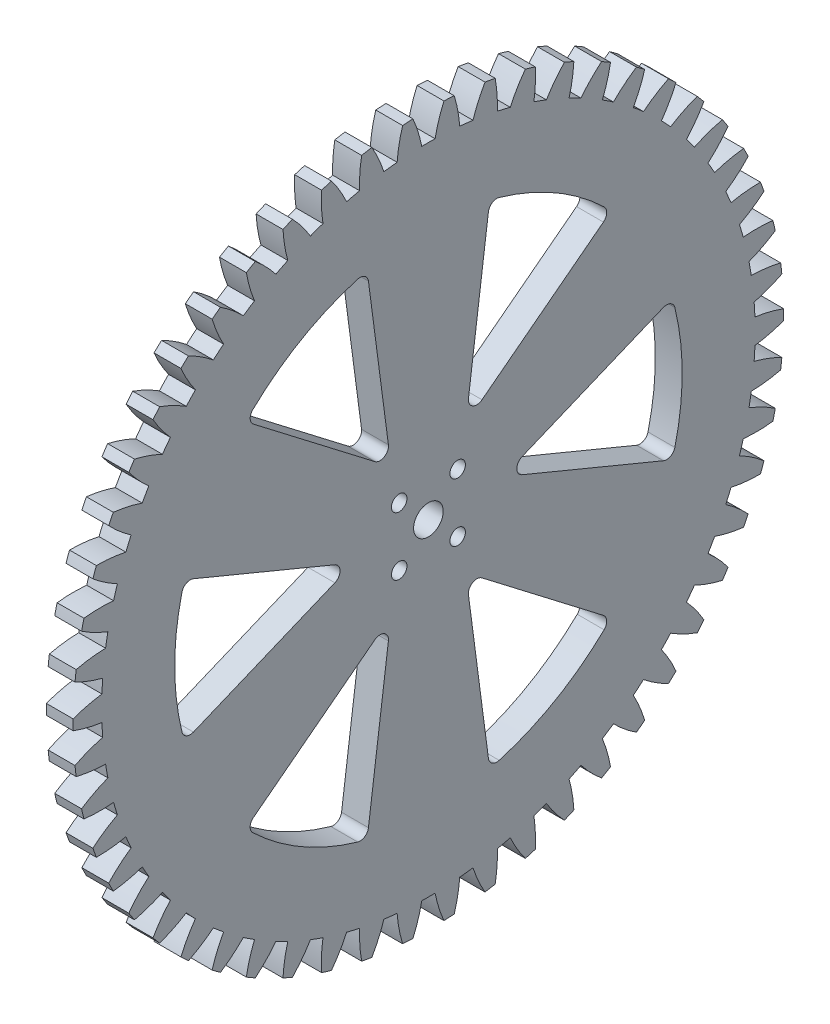
from build123d import *

# Parameters (mm, degrees)
BASPROSKE_W                        = 6.35
BASPROSKE_H                        = 84
TOOTHCUT_DEPTH                     = 119.963534329
TEETHCUTS_COUNT                    = 54
TEETHCUTS_ANGLE                    = 353.333333333
BORSKE_R                           = 3.5
BORE_DEPTH                         = 50.0000508
ENL_V_MAT_EXTRU_1_REACH            = 120.907
ESQUISSE1_R                        = 1.83
R_P_TITION_CIRCULAIRE1_COUNT       = 4
ENL_V_MAT_EXTRU_2_REACH            = 120.907
CONG_1_R                           = 2
R_P_TITION_CIRCULAIRE2_COUNT       = 6
CONG_1_OF_R_P_TITION_CIRCULAIRE2_R = 2


with BuildPart() as part:
    # BasProSke → Base-Revolve (revolve)
    with BuildSketch(Plane(origin=(0, 0, 0), x_dir=(1, 0, 0), z_dir=(0, 1, 0))):
        with Locations((3.175, 42)):
            Rectangle(BASPROSKE_W, BASPROSKE_H)
    revolve(axis=Axis((-10, 0, 0), (1, 0, 0)))

    # TooCutSke → ToothCut (cut, through all)
    with BuildSketch(Plane(origin=(0, 0, 0), x_dir=(0, 0, -1), z_dir=(1, 0, 0))):
        with BuildLine():
            ThreePointArc((1.575386603, 77.232934413), (0, 77.249), (-1.575386603, 77.232934413))
            ThreePointArc((-1.575386603, 77.232934413), (-2.443081828, 80.646109861), (-3.676100496, 83.944947021))
            ThreePointArc((-3.676100496, 83.944947021), (0, 84.0254), (3.676100496, 83.944947021))
            ThreePointArc((3.676100496, 83.944947021), (2.443081828, 80.646109861), (1.575386603, 77.232934413))
        make_face()
    toothcut = extrude(amount=TOOTHCUT_DEPTH, mode=Mode.SUBTRACT)

    # TeethCuts: ToothCut ×54 about axis
    teethcuts_axis = Axis((-10, 0, 0), (1, 0, 0))
    for i in range(1, TEETHCUTS_COUNT):
        add(toothcut.rotate(teethcuts_axis, i * TEETHCUTS_ANGLE / (TEETHCUTS_COUNT - 1)), mode=Mode.SUBTRACT)

    # BorSke → Bore (cut, symmetric)
    with BuildSketch(Plane(origin=(0, 0, 0), x_dir=(0, 0, -1), z_dir=(1, 0, 0))):
        Circle(BORSKE_R)
    extrude(amount=BORE_DEPTH, both=True, mode=Mode.SUBTRACT)

    # Esquisse1 → Enlèv. mat.-Extru.1 (cut, up to next)
    with BuildSketch(Plane.ZY, mode=Mode.PRIVATE) as enl_v_mat_extru_1_sk1:
        with Locations((6.914797213, 6.914797213)):
            Circle(ESQUISSE1_R)
    enl_v_mat_extru_1_tool1 = extrude(enl_v_mat_extru_1_sk1.sketch, amount=-ENL_V_MAT_EXTRU_1_REACH, mode=Mode.PRIVATE) & part.part
    enl_v_mat_extru_1 = enl_v_mat_extru_1_tool1.solids().sort_by_distance((0, 6.914797, 6.914797))[0]
    add(enl_v_mat_extru_1, mode=Mode.SUBTRACT)

    # Répétition circulaire1: Enlèv. mat.-Extru.1 ×4 about axis
    r_p_tition_circulaire1_axis = Axis((0, 0, 0), (-1, 0, 0))
    for i in range(1, R_P_TITION_CIRCULAIRE1_COUNT):
        add(enl_v_mat_extru_1.rotate(r_p_tition_circulaire1_axis, i * 360 / R_P_TITION_CIRCULAIRE1_COUNT), mode=Mode.SUBTRACT)

    # Esquisse2 → Enlèv. mat.-Extru.2 (cut, up to next)
    with BuildSketch(Plane.ZY, mode=Mode.PRIVATE) as enl_v_mat_extru_2_sk1:
        with BuildLine():
            Line((17.667004427, 0), (57.667004427, 16.568542495))
            ThreePointArc((57.667004427, 16.568542495), (60, 0), (57.667004427, -16.568542495))
            Line((57.667004427, -16.568542495), (17.667004427, 0))
        make_face()
    enl_v_mat_extru_2_tool1 = extrude(enl_v_mat_extru_2_sk1.sketch, amount=-ENL_V_MAT_EXTRU_2_REACH, mode=Mode.PRIVATE) & part.part
    enl_v_mat_extru_2 = enl_v_mat_extru_2_tool1.solids().sort_by_distance((0, 0, 45.366966))[0]
    add(enl_v_mat_extru_2, mode=Mode.SUBTRACT)

    # Congé1
    cong_1_edges = [part.edges().sort_by_distance(p)[0] for p in [
        (3.175, 0, 17.667004427),
        (3.175, -16.568542495, 57.667004427),
        (3.175, 16.568542495, 57.667004427),
    ]]
    fillet(cong_1_edges, radius=CONG_1_R)

    # Répétition circulaire2: Enlèv. mat.-Extru.2 ×6 about axis
    r_p_tition_circulaire2_axis = Axis((0, 0, 0), (-1, 0, 0))
    for i in range(1, R_P_TITION_CIRCULAIRE2_COUNT):
        add(enl_v_mat_extru_2.rotate(r_p_tition_circulaire2_axis, i * 360 / R_P_TITION_CIRCULAIRE2_COUNT), mode=Mode.SUBTRACT)

    # Congé1 of Répétition circulaire2
    cong_1_of_r_p_tition_circulaire2_edges = [part.edges().sort_by_distance(p)[0] for p in [
        (3.175, 15.300074643, 8.833502214),
        (3.175, 41.656819547, 43.182280918),
        (3.175, 58.225362041, 14.484723509),
        (3.175, 15.300074643, -8.833502214),
        (3.175, 58.225362041, -14.484723509),
        (3.175, 41.656819547, -43.182280918),
        (3.175, 0, -17.667004427),
        (3.175, 16.568542495, -57.667004427),
        (3.175, -16.568542495, -57.667004427),
        (3.175, -15.300074643, -8.833502214),
        (3.175, -41.656819547, -43.182280918),
        (3.175, -58.225362041, -14.484723509),
        (3.175, -15.300074643, 8.833502214),
        (3.175, -58.225362041, 14.484723509),
        (3.175, -41.656819547, 43.182280918),
    ]]
    fillet(cong_1_of_r_p_tition_circulaire2_edges, radius=CONG_1_OF_R_P_TITION_CIRCULAIRE2_R)


solid = part.part
